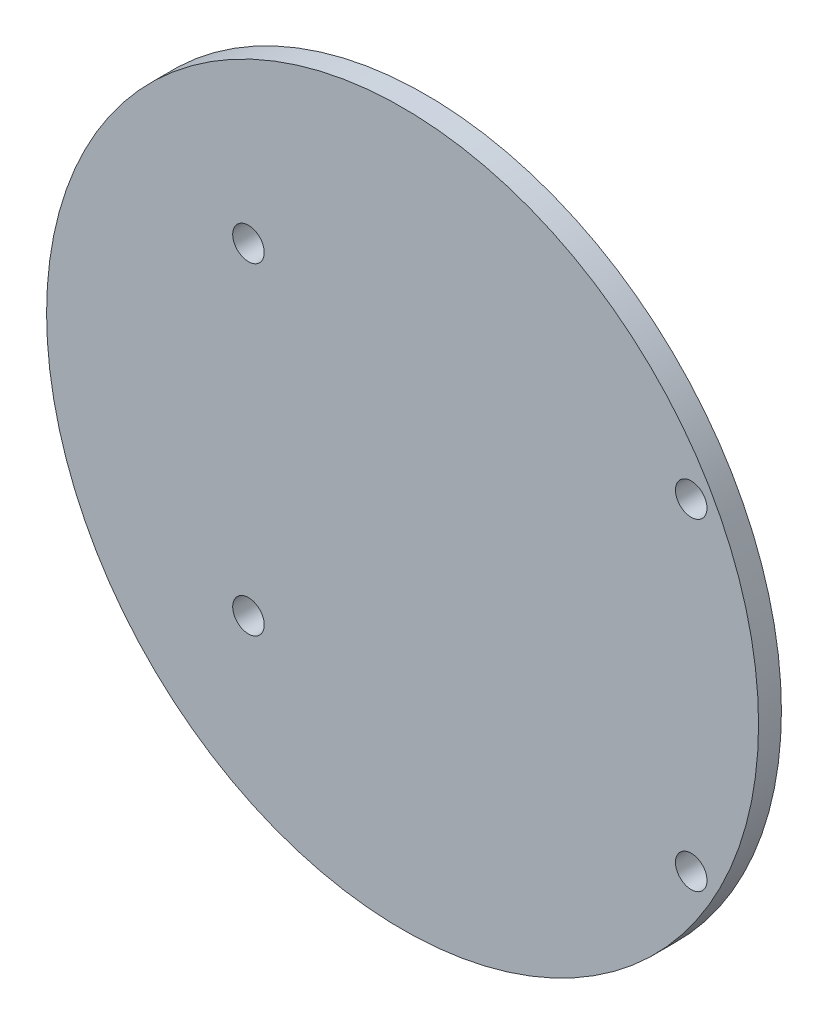
from build123d import *

# Parameters (mm, degrees)
SKETCH1_R              = 25.527
BOARD_DEPTH            = 1.64
SKETCH2_R              = 1.13
NON_PLATED_HOLES_DEPTH = 76.631539572


with BuildPart() as part:
    # Sketch1 → BOARD (new body)
    with BuildSketch(Plane.XY):
        with Locations((27.94, 27.94)):
            Circle(SKETCH1_R)
    extrude(amount=BOARD_DEPTH)

    # Sketch2 → NON-PLATED HOLES (cut, through all)
    with BuildSketch(Plane.XY):
        with Locations((48.64, 39.5)):
            Circle(SKETCH2_R)
        with Locations((48.64, 16.38)):
            Circle(SKETCH2_R)
        with Locations((16.89, 39.5)):
            Circle(SKETCH2_R)
        with Locations((16.89, 16.38)):
            Circle(SKETCH2_R)
    extrude(amount=NON_PLATED_HOLES_DEPTH, mode=Mode.SUBTRACT)


solid = part.part
